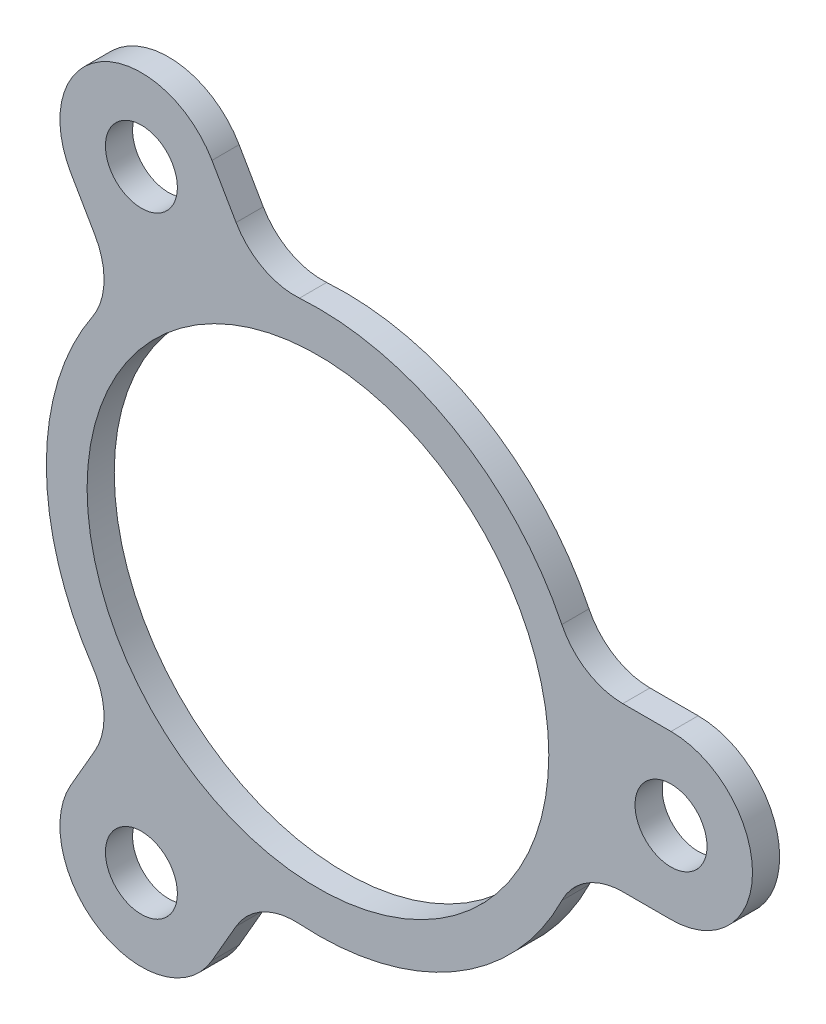
from build123d import *

# Parameters (mm, degrees)
SKETCH1_R            = 17
BOSS_EXTRUDE1_DEPTH  = 2
M5_CLEARANCE_HOLE1_D = 5.3
FILLET1_R            = 5


with BuildPart() as part:
    # Sketch1 → Boss-Extrude1 (new body)
    with BuildSketch(Plane.XY.offset(94.7)):
        with BuildLine():
            ThreePointArc((26, -6), (32, 0), (26, 6))
            Line((26, 6), (19.078784028, 6))
            ThreePointArc((19.078784028, 6), (10, 17.320508076), (-4.343239591, 19.522711642))
            Line((-4.343239591, 19.522711642), (-7.803847577, 25.516660498))
            ThreePointArc((-7.803847577, 25.516660498), (-16, 27.712812921), (-18.196152423, 19.516660498))
            Line((-18.196152423, 19.516660498), (-14.735544437, 13.522711642))
            ThreePointArc((-14.735544437, 13.522711642), (-20, 0), (-14.735544437, -13.522711642))
            Line((-14.735544437, -13.522711642), (-18.196152423, -19.516660498))
            ThreePointArc((-18.196152423, -19.516660498), (-16, -27.712812921), (-7.803847577, -25.516660498))
            Line((-7.803847577, -25.516660498), (-4.343239591, -19.522711642))
            ThreePointArc((-4.343239591, -19.522711642), (10, -17.320508076), (19.078784028, -6))
            Line((19.078784028, -6), (26, -6))
        make_face()
        Circle(SKETCH1_R, mode=Mode.SUBTRACT)
    extrude(amount=BOSS_EXTRUDE1_DEPTH)

    # M5 Clearance Hole1 (through all)
    with Locations(Plane.XY.offset(96.7)):
        with Locations((-13, 22.516660498), (26, 0), (-13, -22.516660498)):
            Hole(M5_CLEARANCE_HOLE1_D / 2)

    # Fillet1
    fillet1_edges = [part.edges().sort_by_distance(p)[0] for p in [
        (-4.343239591, -19.522711642, 95.7),
        (19.078784028, -6, 95.7),
        (19.078784028, 6, 95.7),
        (-4.343239591, 19.522711642, 95.7),
        (-14.735544437, 13.522711642, 95.7),
        (-14.735544437, -13.522711642, 95.7),
    ]]
    fillet(fillet1_edges, radius=FILLET1_R)


solid = part.part
